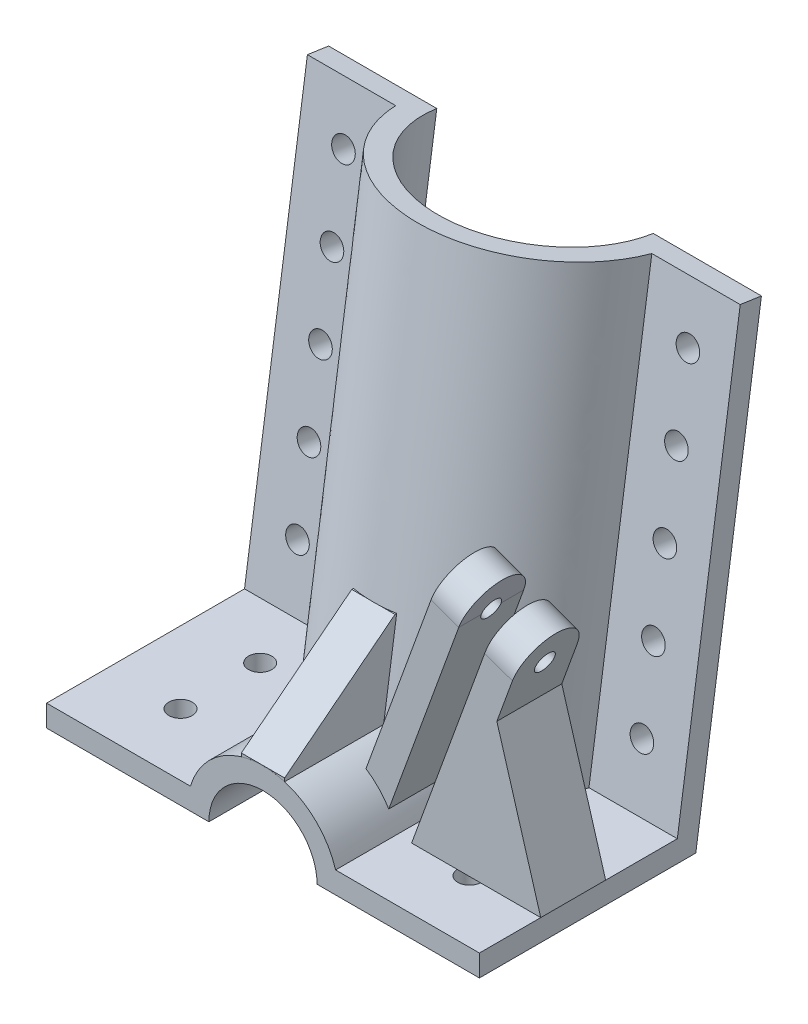
from build123d import *

# Parameters (mm, degrees)
BOSS_EXTRUDE1_DEPTH      = 50
SKETCH4_W                = 125
SKETCH4_H                = 20.994005762
CUT_EXTRUDE1_DEPTH       = 50
CUT_EXTRUDE2_START       = -50
CUT_EXTRUDE2_DEPTH       = 50
CUT_EXTRUDE4_REACH       = 128.825
SKETCH8_R                = 2.7
BOSS_EXTRUDE2_DEPTH      = 2
BOSS_EXTRUDE2_DEPTH_BACK = 20
SKETCH11_W               = 10
SKETCH11_H               = 26.340783312
CUT_EXTRUDE6_REACH       = 133.26
CUT_EXTRUDE3_REACH       = 127.089
SKETCH7_R                = 2.7
BOSS_EXTRUDE3_DEPTH      = 10
BOSS_EXTRUDE3_DEPTH_BACK = 10
SKETCH15_R               = 2.3
CUT_EXTRUDE7_DEPTH       = 15
SKETCH18_W               = 6.807466682
SKETCH18_H               = 15
BOSS_EXTRUDE5_DEPTH      = 31
SKETCH19_W               = 6.808570261
SKETCH19_H               = 15
BOSS_EXTRUDE6_DEPTH      = 34


with BuildPart() as part:
    # Sketch1 → Boss-Extrude1 (new body)
    with BuildSketch(Plane.XY):
        with BuildLine():
            Line((-12.5, 0), (-50, 0))
            Line((-50, 0), (-50, 5))
            Line((-50, 5), (-16.770509831, 5))
            ThreePointArc((-16.770509831, 5), (0, 17.5), (16.770509831, 5))
            Line((16.770509831, 5), (50, 5))
            Line((50, 5), (50, 0))
            Line((50, 0), (12.5, 0))
            ThreePointArc((12.5, 0), (0, 12.5), (-12.5, 0))
        make_face()
    extrude(amount=BOSS_EXTRUDE1_DEPTH)

    # Sweep1: sweep along a path in Sketch3
    with BuildLine(Plane.ZY) as sweep1_path:
        Line((0, 0), (-15.87918211, 108.847836798))
    # Sketch2 → Sweep1 (sweep)
    with BuildSketch(Plane.XZ):
        with BuildLine():
            Line((-25, 0), (-50, 0))
            Line((-50, 0), (-50, 5))
            Line((-50, 5), (-29.580398915, 5))
            ThreePointArc((-29.580398915, 5), (0, 30), (29.580398915, 5))
            Line((29.580398915, 5), (50, 5))
            Line((50, 5), (50, 0))
            Line((50, 0), (25, 0))
            ThreePointArc((25, 0), (0, 25), (-25, 0))
        make_face()
    sweep(path=sweep1_path.line)

    # Sketch4 → Cut-Extrude1 (cut)
    with BuildSketch(Plane(origin=(0, 0, 0), x_dir=(-1, 0, 0), z_dir=(0, -0.14435620100097693, -0.989525789068969))):
        with Locations((12.5, 115.497002881)):
            Rectangle(SKETCH4_W, SKETCH4_H)
    extrude(amount=-CUT_EXTRUDE1_DEPTH, mode=Mode.SUBTRACT)

    # Sketch6 → Cut-Extrude2 (cut)
    with BuildSketch(Plane.XY.offset(50).offset(CUT_EXTRUDE2_START)):
        with BuildLine():
            Line((-12.5, 0), (12.5, 0))
            ThreePointArc((12.5, 0), (0, 12.5), (-12.5, 0))
        make_face()
    extrude(amount=CUT_EXTRUDE2_DEPTH, mode=Mode.SUBTRACT)

    # Sketch8 → Cut-Extrude4 (cut, up to next)
    with BuildSketch(Plane(origin=(0, 0.714220919, 4.895806436), x_dir=(1, 0, 0), z_dir=(0, 0.14435620100097693, 0.989525789068969)), mode=Mode.PRIVATE) as cut_extrude4_sk1:
        with Locations((39.790199458, 92)):
            Circle(SKETCH8_R)
    cut_extrude4_tool1 = extrude(cut_extrude4_sk1.sketch, amount=-CUT_EXTRUDE4_REACH, mode=Mode.PRIVATE) & part.part
    # Sketch8 → Cut-Extrude4 (cut, up to next)
    with BuildSketch(Plane(origin=(0, 0.714220919, 4.895806436), x_dir=(1, 0, 0), z_dir=(0, 0.14435620100097693, 0.989525789068969)), mode=Mode.PRIVATE) as cut_extrude4_sk2:
        with Locations((39.790199458, 73.6)):
            Circle(SKETCH8_R)
    cut_extrude4_tool2 = extrude(cut_extrude4_sk2.sketch, amount=-CUT_EXTRUDE4_REACH, mode=Mode.PRIVATE) & part.part
    # Sketch8 → Cut-Extrude4 (cut, up to next)
    with BuildSketch(Plane(origin=(0, 0.714220919, 4.895806436), x_dir=(1, 0, 0), z_dir=(0, 0.14435620100097693, 0.989525789068969)), mode=Mode.PRIVATE) as cut_extrude4_sk3:
        with Locations((39.790199458, 55.2)):
            Circle(SKETCH8_R)
    cut_extrude4_tool3 = extrude(cut_extrude4_sk3.sketch, amount=-CUT_EXTRUDE4_REACH, mode=Mode.PRIVATE) & part.part
    # Sketch8 → Cut-Extrude4 (cut, up to next)
    with BuildSketch(Plane(origin=(0, 0.714220919, 4.895806436), x_dir=(1, 0, 0), z_dir=(0, 0.14435620100097693, 0.989525789068969)), mode=Mode.PRIVATE) as cut_extrude4_sk4:
        with Locations((39.790199458, 36.8)):
            Circle(SKETCH8_R)
    cut_extrude4_tool4 = extrude(cut_extrude4_sk4.sketch, amount=-CUT_EXTRUDE4_REACH, mode=Mode.PRIVATE) & part.part
    # Sketch8 → Cut-Extrude4 (cut, up to next)
    with BuildSketch(Plane(origin=(0, 0.714220919, 4.895806436), x_dir=(1, 0, 0), z_dir=(0, 0.14435620100097693, 0.989525789068969)), mode=Mode.PRIVATE) as cut_extrude4_sk5:
        with Locations((39.790199458, 18.4)):
            Circle(SKETCH8_R)
    cut_extrude4_tool5 = extrude(cut_extrude4_sk5.sketch, amount=-CUT_EXTRUDE4_REACH, mode=Mode.PRIVATE) & part.part
    # Sketch8 → Cut-Extrude4 (cut, up to next)
    with BuildSketch(Plane(origin=(0, 0.714220919, 4.895806436), x_dir=(1, 0, 0), z_dir=(0, 0.14435620100097693, 0.989525789068969)), mode=Mode.PRIVATE) as cut_extrude4_sk6:
        with Locations((-39.790199458, 18.4)):
            Circle(SKETCH8_R)
    cut_extrude4_tool6 = extrude(cut_extrude4_sk6.sketch, amount=-CUT_EXTRUDE4_REACH, mode=Mode.PRIVATE) & part.part
    # Sketch8 → Cut-Extrude4 (cut, up to next)
    with BuildSketch(Plane(origin=(0, 0.714220919, 4.895806436), x_dir=(1, 0, 0), z_dir=(0, 0.14435620100097693, 0.989525789068969)), mode=Mode.PRIVATE) as cut_extrude4_sk7:
        with Locations((-39.790199458, 36.8)):
            Circle(SKETCH8_R)
    cut_extrude4_tool7 = extrude(cut_extrude4_sk7.sketch, amount=-CUT_EXTRUDE4_REACH, mode=Mode.PRIVATE) & part.part
    # Sketch8 → Cut-Extrude4 (cut, up to next)
    with BuildSketch(Plane(origin=(0, 0.714220919, 4.895806436), x_dir=(1, 0, 0), z_dir=(0, 0.14435620100097693, 0.989525789068969)), mode=Mode.PRIVATE) as cut_extrude4_sk8:
        with Locations((-39.790199458, 55.2)):
            Circle(SKETCH8_R)
    cut_extrude4_tool8 = extrude(cut_extrude4_sk8.sketch, amount=-CUT_EXTRUDE4_REACH, mode=Mode.PRIVATE) & part.part
    # Sketch8 → Cut-Extrude4 (cut, up to next)
    with BuildSketch(Plane(origin=(0, 0.714220919, 4.895806436), x_dir=(1, 0, 0), z_dir=(0, 0.14435620100097693, 0.989525789068969)), mode=Mode.PRIVATE) as cut_extrude4_sk9:
        with Locations((-39.790199458, 73.6)):
            Circle(SKETCH8_R)
    cut_extrude4_tool9 = extrude(cut_extrude4_sk9.sketch, amount=-CUT_EXTRUDE4_REACH, mode=Mode.PRIVATE) & part.part
    # Sketch8 → Cut-Extrude4 (cut, up to next)
    with BuildSketch(Plane(origin=(0, 0.714220919, 4.895806436), x_dir=(1, 0, 0), z_dir=(0, 0.14435620100097693, 0.989525789068969)), mode=Mode.PRIVATE) as cut_extrude4_sk10:
        with Locations((-39.790199458, 92)):
            Circle(SKETCH8_R)
    cut_extrude4_tool10 = extrude(cut_extrude4_sk10.sketch, amount=-CUT_EXTRUDE4_REACH, mode=Mode.PRIVATE) & part.part
    add(cut_extrude4_tool1.solids().sort_by_distance((39.790199, 91.750594, -8.384964))[0], mode=Mode.SUBTRACT)
    add(cut_extrude4_tool2.solids().sort_by_distance((39.790199, 73.543319, -5.72881))[0], mode=Mode.SUBTRACT)
    add(cut_extrude4_tool3.solids().sort_by_distance((39.790199, 55.336044, -3.072656))[0], mode=Mode.SUBTRACT)
    add(cut_extrude4_tool4.solids().sort_by_distance((39.790199, 37.12877, -0.416502))[0], mode=Mode.SUBTRACT)
    add(cut_extrude4_tool5.solids().sort_by_distance((39.790199, 18.921495, 2.239652))[0], mode=Mode.SUBTRACT)
    add(cut_extrude4_tool6.solids().sort_by_distance((-39.790199, 18.921495, 2.239652))[0], mode=Mode.SUBTRACT)
    add(cut_extrude4_tool7.solids().sort_by_distance((-39.790199, 37.12877, -0.416502))[0], mode=Mode.SUBTRACT)
    add(cut_extrude4_tool8.solids().sort_by_distance((-39.790199, 55.336044, -3.072656))[0], mode=Mode.SUBTRACT)
    add(cut_extrude4_tool9.solids().sort_by_distance((-39.790199, 73.543319, -5.72881))[0], mode=Mode.SUBTRACT)
    add(cut_extrude4_tool10.solids().sort_by_distance((-39.790199, 91.750594, -8.384964))[0], mode=Mode.SUBTRACT)

    # Cut-Sweep1: sweep along a path in Sketch13
    with BuildLine(Plane.ZY) as cut_sweep1_path:
        Line((-15.157401105, 103.900207852), (0, 0))
        Line((0, 0), (1.599629979, -10.965064928))
    # Sketch5 → Cut-Sweep1 (sweep, cut)
    with BuildSketch(Plane(origin=(0, 103.900207852, -15.157401105), x_dir=(1, 0, 0), z_dir=(0, 0.989525789068969, -0.14435620100097696))):
        with BuildLine():
            Line((25, 0), (50, 0))
            Line((50, 0), (50, 3.182703193))
            Line((50, 3.182703193), (-62.855782444, 3.182703193))
            Line((-62.855782444, 3.182703193), (-62.855782444, 0))
            Line((-62.855782444, 0), (-25, 0))
            ThreePointArc((-25, 0), (0, -25), (25, 0))
        make_face()
    sweep(path=cut_sweep1_path.line, mode=Mode.SUBTRACT)

    # Sketch11 → Boss-Extrude2 (add, two sides: drawn at the far end of the back side and taken through both)
    with BuildSketch(Plane(origin=(0, 17.5, 0), x_dir=(-1, 0, 0), z_dir=(0, -1, 0)).offset(-BOSS_EXTRUDE2_DEPTH_BACK)):
        with Locations((0, -36.827423554)):
            Rectangle(SKETCH11_W, SKETCH11_H)
    extrude(amount=BOSS_EXTRUDE2_DEPTH + BOSS_EXTRUDE2_DEPTH_BACK)

    # Sketch14 → Cut-Extrude6 (cut, up to next)
    with BuildSketch(Plane(origin=(5, 0, 0), x_dir=(0, 0, -1), z_dir=(1, 0, 0)), mode=Mode.PRIVATE) as cut_extrude6_sk1:
        Polygon((-24.499338888, 37.5), (-49.99781521, 17.5210903), (-49.99781521, 37.5), align=None)
    cut_extrude6_tool1 = extrude(cut_extrude6_sk1.sketch, amount=-CUT_EXTRUDE6_REACH, mode=Mode.PRIVATE) & part.part
    add(cut_extrude6_tool1.solids().sort_by_distance((5, 30.840363, 41.498323))[0], mode=Mode.SUBTRACT)

    # Sketch7 → Cut-Extrude3 (cut, up to next)
    with BuildSketch(Plane(origin=(0, 5, 0), x_dir=(1, 0, 0), z_dir=(0, 1, 0)), mode=Mode.PRIVATE) as cut_extrude3_sk1:
        with Locations((33.385254916, -17.270578884)):
            Circle(SKETCH7_R)
    cut_extrude3_tool1 = extrude(cut_extrude3_sk1.sketch, amount=-CUT_EXTRUDE3_REACH, mode=Mode.PRIVATE) & part.part
    # Sketch7 → Cut-Extrude3 (cut, up to next)
    with BuildSketch(Plane(origin=(0, 5, 0), x_dir=(1, 0, 0), z_dir=(0, 1, 0)), mode=Mode.PRIVATE) as cut_extrude3_sk2:
        with Locations((33.385254916, -35.670578884)):
            Circle(SKETCH7_R)
    cut_extrude3_tool2 = extrude(cut_extrude3_sk2.sketch, amount=-CUT_EXTRUDE3_REACH, mode=Mode.PRIVATE) & part.part
    # Sketch7 → Cut-Extrude3 (cut, up to next)
    with BuildSketch(Plane(origin=(0, 5, 0), x_dir=(1, 0, 0), z_dir=(0, 1, 0)), mode=Mode.PRIVATE) as cut_extrude3_sk3:
        with Locations((-33.385254916, -35.670578884)):
            Circle(SKETCH7_R)
    cut_extrude3_tool3 = extrude(cut_extrude3_sk3.sketch, amount=-CUT_EXTRUDE3_REACH, mode=Mode.PRIVATE) & part.part
    # Sketch7 → Cut-Extrude3 (cut, up to next)
    with BuildSketch(Plane(origin=(0, 5, 0), x_dir=(1, 0, 0), z_dir=(0, 1, 0)), mode=Mode.PRIVATE) as cut_extrude3_sk4:
        with Locations((-33.385254916, -17.270578884)):
            Circle(SKETCH7_R)
    cut_extrude3_tool4 = extrude(cut_extrude3_sk4.sketch, amount=-CUT_EXTRUDE3_REACH, mode=Mode.PRIVATE) & part.part
    add(cut_extrude3_tool1.solids().sort_by_distance((33.385255, 5, 17.270579))[0], mode=Mode.SUBTRACT)
    add(cut_extrude3_tool2.solids().sort_by_distance((33.385255, 5, 35.670579))[0], mode=Mode.SUBTRACT)
    add(cut_extrude3_tool3.solids().sort_by_distance((-33.385255, 5, 35.670579))[0], mode=Mode.SUBTRACT)
    add(cut_extrude3_tool4.solids().sort_by_distance((-33.385255, 5, 17.270579))[0], mode=Mode.SUBTRACT)



with BuildPart() as body_2:
    # Sketch15 → Boss-Extrude3 (new, two sides: drawn at the far end of the back side and taken through both)
    with BuildSketch(Plane(origin=(13.201763824, -4.805049072, 0), x_dir=(0, 0, -1), z_dir=(-0.9396926207859081, 0.34202014332566943, 0)).offset(-BOSS_EXTRUDE3_DEPTH_BACK)):
        with BuildLine():
            Line((-35.830918033, -44.290464645), (-20.830918033, -44.290464645))
            Line((-20.830918033, -44.290464645), (-20.830918033, -60.991505391))
            ThreePointArc((-20.830918033, -60.991505391), (-28.330918033, -68.491505391), (-35.830918033, -60.991505391))
            Line((-35.830918033, -60.991505391), (-35.830918033, -44.290464645))
        make_face()
        with Locations((-28.330918033, -60.991505391)):
            Circle(SKETCH15_R, mode=Mode.SUBTRACT)
    extrude(amount=BOSS_EXTRUDE3_DEPTH + BOSS_EXTRUDE3_DEPTH_BACK)

    # Sketch16 → Cut-Extrude7 (cut)
    with BuildSketch(Plane.XY.offset(35.830918033)):
        Polygon((31.062087239, 53.600129178), (25.349994889, 37.906284429), (28.349476378, 36.814562449), (31.348957866, 35.722840469), (37.061050216, 51.416685218), (39.532046491, 58.733241596), (33.719454717, 60.860660581), align=None)
    extrude(amount=-CUT_EXTRUDE7_DEPTH, mode=Mode.SUBTRACT)


with BuildPart() as cut_extrude7_piece_1:
    # of the separate pieces the step leaves, piece 1, a body of its own (cut_extrude7_pieces)
    add(body_2.part.solids().sort_by_distance((43.459013447, 49.088017042, 20.830918033))[0])


with BuildPart() as cut_extrude7_piece_2:
    # of the separate pieces the step leaves, piece 2, a body of its own (cut_extrude7_pieces)
    add(body_2.part.solids().sort_by_distance((31.062087239, 53.600129178, 20.830918033))[0])


with BuildPart() as part_1:
    add(part.part)

    add(cut_extrude7_piece_2.part)  # Boss-Extrude5 merges Cut-Extrude7 piece 2
    # Sketch18 → Boss-Extrude5 (add)
    with BuildSketch(Plane(origin=(15.148231066, 41.619422798, 0), x_dir=(0.9396926207859082, -0.34202014332566943, 0), z_dir=(-0.34202014332566943, -0.9396926207859082, 0))):
        with Locations((7.45275696, 28.330918033)):
            Rectangle(SKETCH18_W, SKETCH18_H)
    extrude(amount=BOSS_EXTRUDE5_DEPTH)


    add(cut_extrude7_piece_1.part)  # Boss-Extrude6 merges Cut-Extrude7 piece 1
    # Sketch19 → Boss-Extrude6 (add)
    with BuildSketch(Plane(origin=(15.148231066, 41.619422798, 0), x_dir=(0.9396926207859082, -0.34202014332566943, 0), z_dir=(-0.34202014332566943, -0.9396926207859082, 0))):
        with Locations((20.644738488, 28.330918033)):
            Rectangle(SKETCH19_W, SKETCH19_H)
    extrude(amount=BOSS_EXTRUDE6_DEPTH)

    # Sketch21 → Loft4 section 0
    with BuildSketch(Plane(origin=(0, 5, 0), x_dir=(1, 0, 0), z_dir=(0, 1, 0))):
        with BuildLine():
            Line((28.164991837, -35.830918033), (50, -35.830918033))
            Line((50, -35.830918033), (50, -20.830918033))
            Line((50, -20.830918033), (28.164991837, -20.830918033))
            Line((28.164991837, -20.830918033), (28.164991837, -35.830918033))
        make_face()
    # Sketch22 → Loft4 section 1
    with BuildSketch(Plane(origin=(22.598690032, -8.225250505, 0), x_dir=(0, 0, -1), z_dir=(0.9396926207859082, -0.34202014332566943, 0))):
        with BuildLine():
            Line((-35.830918033, 14.074017623), (-20.830918033, 14.074017623))
            Line((-20.830918033, 14.074017623), (-20.830918033, 50.477511146))
            Line((-20.830918033, 50.477511146), (-35.830918033, 50.477511146))
            Line((-35.830918033, 50.477511146), (-35.830918033, 14.074017623))
        make_face()
    loft()


solid = part_1.part
